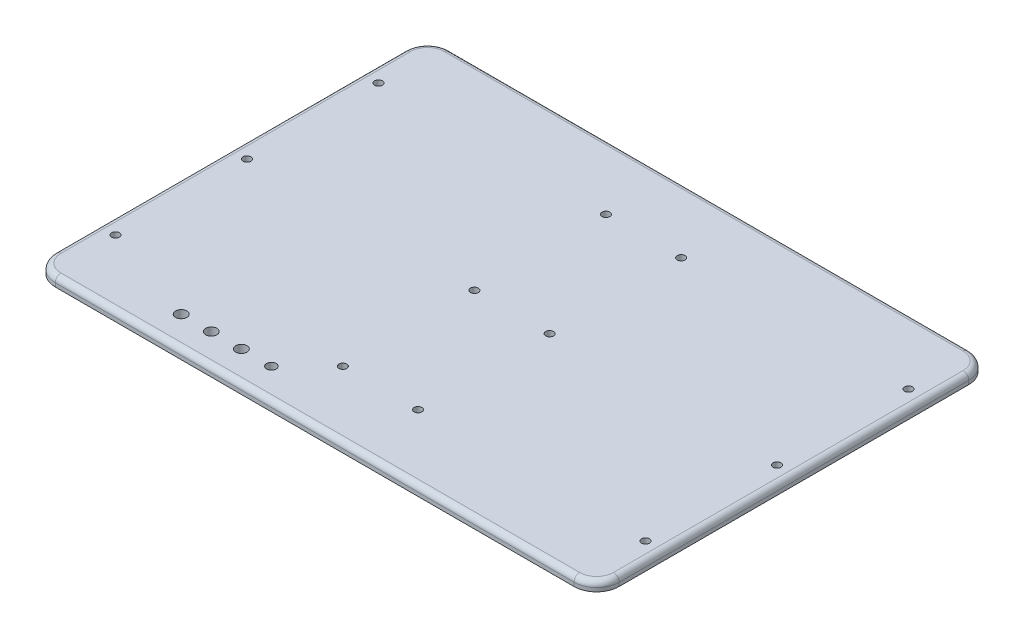
from build123d import *

# Parameters (mm, degrees)
SKETCH1_W           = 300
SKETCH1_H           = 210
BOSS_EXTRUDE1_DEPTH = 5
FILLET1_R           = 12
SKETCH2_R           = 2.075
CUT_EXTRUDE1_DEPTH  = 184.16659084
FILLET2_R           = 3
SKETCH3_R           = 3
SKETCH3_R_2         = 2.56
CUT_EXTRUDE2_DEPTH  = 184.16659084


with BuildPart() as part:
    # Sketch1 → Boss-Extrude1 (new body)
    with BuildSketch(Plane(origin=(0, 0, 0), x_dir=(1, 0, 0), z_dir=(0, 1, 0))):
        Rectangle(SKETCH1_W, SKETCH1_H)
    extrude(amount=BOSS_EXTRUDE1_DEPTH)

    # Fillet1
    fillet1_edges = [part.edges().sort_by_distance(p)[0] for p in [
        (150, 2.5, -105),
        (150, 2.5, 105),
        (-150, 2.5, 105),
        (-150, 2.5, -105),
    ]]
    fillet(fillet1_edges, radius=FILLET1_R)

    # Sketch2 → Cut-Extrude1 (cut, through all)
    with BuildSketch(Plane(origin=(0, 5, 0), x_dir=(1, 0, 0), z_dir=(0, 1, 0))):
        with Locations((-141, 70)):
            Circle(SKETCH2_R)
        with Locations((-141, 0)):
            Circle(SKETCH2_R)
        with Locations((-141, -70)):
            Circle(SKETCH2_R)
        with Locations((-20, 70)):
            Circle(SKETCH2_R)
        with Locations((-20, 0)):
            Circle(SKETCH2_R)
        with Locations((-20, -70)):
            Circle(SKETCH2_R)
    cut_extrude1 = extrude(amount=-CUT_EXTRUDE1_DEPTH, mode=Mode.SUBTRACT)

    # Mirror1: Cut-Extrude1 across plane
    add(cut_extrude1.mirror(Plane(origin=(0, 0, 0), x_dir=(0, 0, 1), z_dir=(1, 0, 0))), mode=Mode.SUBTRACT)

    # Fillet2
    fillet2_edges = [part.edges().sort_by_distance(p)[0] for p in [
        (146.485281374, 5, -101.485281374),
        (150, 5, 0),
        (146.485281374, 5, 101.485281374),
        (0, 5, 105),
        (-146.485281374, 5, 101.485281374),
        (-150, 5, 0),
        (-146.485281374, 5, -101.485281374),
        (0, 5, -105),
    ]]
    fillet(fillet2_edges, radius=FILLET2_R)

    # Sketch3 → Cut-Extrude2 (cut, through all)
    with BuildSketch(Plane(origin=(0, 5, 0), x_dir=(1, 0, 0), z_dir=(0, 1, 0))):
        with Locations((-87, -89)):
            Circle(SKETCH3_R)
        with Locations((-71, -89)):
            Circle(SKETCH3_R)
        with Locations((-55, -89)):
            Circle(SKETCH3_R)
        with Locations((-39, -89)):
            Circle(SKETCH3_R_2)
    extrude(amount=-CUT_EXTRUDE2_DEPTH, mode=Mode.SUBTRACT)


solid = part.part
